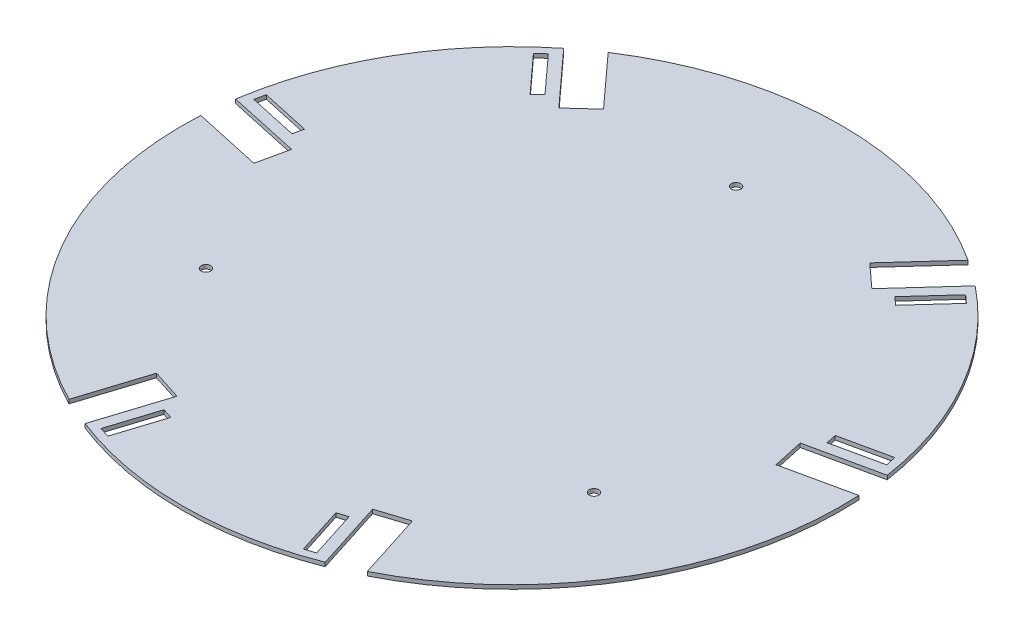
from build123d import *

# Parameters (mm, degrees)
SKETCH2_R           = 125
BOSS_EXTRUDE1_DEPTH = 1.5
SKETCH3_W           = 3
SKETCH3_H           = 19
CUT_EXTRUDE1_DEPTH  = 177.783059143
SKETCH4_R           = 1.8
CUT_EXTRUDE2_DEPTH  = 177.783059143
CUT_EXTRUDE5_DEPTH  = 177.783059143
CIRPATTERN2_COUNT   = 3


with BuildPart() as part:
    # Sketch2 → Boss-Extrude1 (new body)
    with BuildSketch(Plane(origin=(0, 0, 0), x_dir=(1, 0, 0), z_dir=(0, 1, 0))):
        Circle(SKETCH2_R)
    extrude(amount=BOSS_EXTRUDE1_DEPTH)

    # Sketch3 → Cut-Extrude1 (cut, through all)
    with BuildSketch(Plane(origin=(0, 1.5, 0), x_dir=(1, 0, 0), z_dir=(0, 1, 0))):
        with Locations((-268.691654721, -368.173324402)):
            Rectangle(SKETCH3_W, SKETCH3_H)
        Polygon((31.312, -98.125219266), (35.122688127, -96.909219266), (40.898688127, -115.009987868), (37.088, -116.225987868), align=None)
        Polygon((-37.088, -116.225987868), (-31.312, -98.125219266), (-35.122688127, -96.909219266), (-40.898688127, -115.009987868), align=None)
        Polygon((-82.110658074, 90.23214411), (-69.322932636, 76.179597076), (-66.364501682, 78.8717498), (-79.15222712, 92.924296834), align=None)
        Polygon((-100.634932636, 21.94562219), (-101.487189809, 18.037469466), (-120.050915246, 22.085691035), (-119.198658074, 25.993843759), align=None)
        Polygon((119.198658074, 25.993843759), (100.634932636, 21.94562219), (101.487189809, 18.037469466), (120.050915246, 22.085691035), align=None)
        Polygon((69.322932636, 76.179597076), (66.364501682, 78.8717498), (79.15222712, 92.924296834), (82.110658074, 90.23214411), align=None)
    extrude(amount=-CUT_EXTRUDE1_DEPTH, mode=Mode.SUBTRACT)

    # Sketch4 → Cut-Extrude2 (cut, through all)
    with BuildSketch(Plane(origin=(0, 1.5, 0), x_dir=(1, 0, 0), z_dir=(0, 1, 0))):
        with Locations((0, 85)):
            Circle(SKETCH4_R)
        with Locations((73.612159322, -42.5)):
            Circle(SKETCH4_R)
        with Locations((-73.612159322, -42.5)):
            Circle(SKETCH4_R)
    extrude(amount=-CUT_EXTRUDE2_DEPTH, mode=Mode.SUBTRACT)

    # Sketch6 → Cut-Extrude5 (cut, through all)
    with BuildSketch(Plane(origin=(0, 1.5, 0), x_dir=(1, 0, 0), z_dir=(0, 1, 0))):
        Polygon((-55.992533724, -149.153029157), (-67.424598105, -145.505029157), (-48.541440634, -86.329187076), (-37.109376254, -89.977187076), align=None)
        Polygon((67.424598105, -145.505029157), (48.541440634, -86.329187076), (37.109376254, -89.977187076), (55.992533724, -149.153029157), align=None)
    cut_extrude5 = extrude(amount=-CUT_EXTRUDE5_DEPTH, mode=Mode.SUBTRACT)

    # CirPattern2: Cut-Extrude5 ×3 about axis
    cirpattern2_axis = Axis((0, 1.5, 0), (0, 1, 0))
    for i in range(1, CIRPATTERN2_COUNT):
        add(cut_extrude5.rotate(cirpattern2_axis, i * 360 / CIRPATTERN2_COUNT), mode=Mode.SUBTRACT)


solid = part.part
